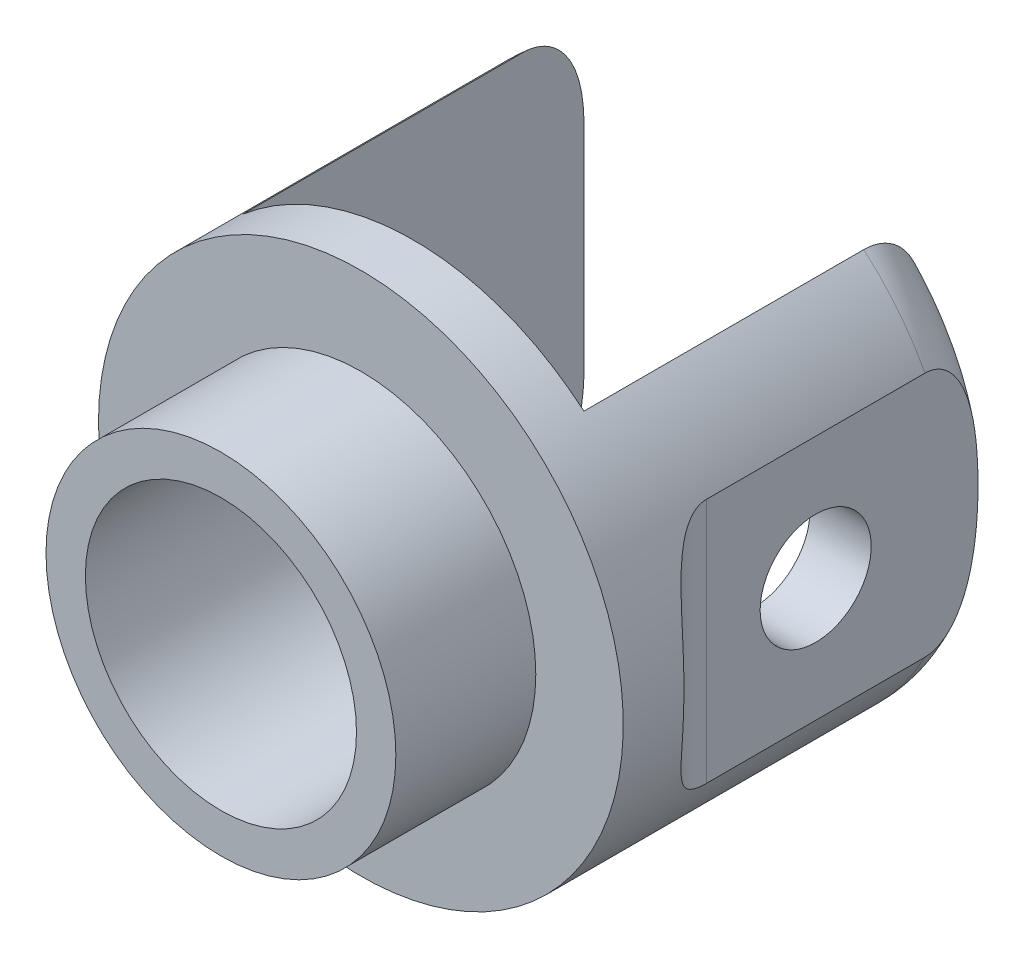
from build123d import *
from build123d.topology import SkipClean

# Parameters (mm, degrees)
SKETCH1_R           = 10
SKETCH1_R_2         = 7.75
BOSS_EXTRUDE1_DEPTH = 8
BOSS_EXTRUDE2_START = 22.5
SKETCH2_R           = 15
SKETCH2_R_2         = 7.75
BOSS_EXTRUDE2_DEPTH = 22.5
CUT_EXTRUDE1_DEPTH  = 19.5
CUT_EXTRUDE2_DEPTH  = 19.5
FILLET2_R           = 3.5
FILLET3_R           = 3.5
SKETCH5_R           = 3.175
CUT_EXTRUDE3_DEPTH  = 28


with BuildPart() as part:
    # Sketch1 → Boss-Extrude1 (new body)
    with BuildSketch(Plane.XY):
        Circle(SKETCH1_R)
        Circle(SKETCH1_R_2, mode=Mode.SUBTRACT)
    extrude(amount=BOSS_EXTRUDE1_DEPTH)

    # Sketch2 → Boss-Extrude2 (add)
    with SkipClean():  # the faces are left unmerged after this step: merging them gives an invalid solid
        with BuildSketch(Plane(origin=(0, 0, 0), x_dir=(-1, 0, 0), z_dir=(0, 0, -1)).offset(BOSS_EXTRUDE2_START)):
            with Locations(Location((0, 0, 0), (0, 0, 180))):
                Circle(SKETCH2_R)
            Circle(SKETCH2_R_2, mode=Mode.SUBTRACT)
        extrude(amount=-BOSS_EXTRUDE2_DEPTH)

    # Sketch3 → Cut-Extrude1 (cut)
    with SkipClean():  # the faces are left unmerged after this step: merging them gives an invalid solid
        with BuildSketch(Plane(origin=(0, 0, -22.5), x_dir=(-1, 0, 0), z_dir=(0, 0, -1))):
            Polygon((-9.75, -18.796133084), (-9.75, 18.796133084), (9.75, 18.796133084), (9.75, -18.796133084), (7.75, -18.796133084), align=None)
        extrude(amount=-CUT_EXTRUDE1_DEPTH, mode=Mode.SUBTRACT)

    # Sketch4 → Cut-Extrude2 (cut)
    with SkipClean():  # the faces are left unmerged after this step: merging them gives an invalid solid
        with BuildSketch(Plane(origin=(0, 0, -22.5), x_dir=(-1, 0, 0), z_dir=(0, 0, -1))):
            Polygon((13.25, 0), (13.25, 9.875321844), (16.822314813, 9.875321844), (16.822314813, -10.062236453), (13.25, -10.062236453), align=None)
            Polygon((-13.25, 0), (-13.25, 9.875321844), (-16.946924552, 9.875321844), (-16.946924552, -10.062236453), (-13.25, -10.062236453), align=None)
        extrude(amount=-CUT_EXTRUDE2_DEPTH, mode=Mode.SUBTRACT)

    # Fillet2
    # the kernel refuses this fillet: 3.5 mm, written as the material it takes off along each edge
    with BuildSketch(Plane(origin=(0, 0, -22.5), x_dir=(-0.9954455514226321, -0.09533181081303158, 0), z_dir=(0.09533181081303158, -0.9954455514226321, 0))) as fillet2_piece_1:
        with BuildLine():
            CenterArc((15 - FILLET2_R, -FILLET2_R), FILLET2_R, 0, 90)
            Line((15 - FILLET2_R, 0), (15, 0))
            Line((15, 0), (15, -FILLET2_R))
        make_face()
    revolve(axis=Axis((0, 0, -22.5), (0, 0, -1)), revolution_arc=88.352120415, mode=Mode.SUBTRACT)
    with BuildSketch(Plane(origin=(0, 0, -22.5), x_dir=(-0.12391837211536041, -0.9922924150935948, 0), z_dir=(0.9922924150935948, -0.12391837211536041, 0))) as fillet2_piece_2:
        with BuildLine():
            CenterArc((15 - FILLET2_R, -FILLET2_R), FILLET2_R, 0, 90)
            Line((15 - FILLET2_R, 0), (15, 0))
            Line((15, 0), (15, -FILLET2_R))
        make_face()
    revolve(axis=Axis((0, 0, -22.5), (0, 0, -1)), revolution_arc=88.352120415, mode=Mode.SUBTRACT)
    with BuildSketch(Plane(origin=(0, 0, -22.5), x_dir=(0.9954455514226316, 0.09533181081303897, 0), z_dir=(-0.09533181081303897, 0.9954455514226316, 0))) as fillet2_piece_3:
        with BuildLine():
            CenterArc((15 - FILLET2_R, -FILLET2_R), FILLET2_R, 0, 90)
            Line((15 - FILLET2_R, 0), (15, 0))
            Line((15, 0), (15, -FILLET2_R))
        make_face()
    revolve(axis=Axis((0, 0, -22.5), (0, 0, -1)), revolution_arc=88.352120415, mode=Mode.SUBTRACT)
    with BuildSketch(Plane(origin=(0, 0, -22.5), x_dir=(0.12391837211539843, 0.9922924150935901, 0), z_dir=(-0.9922924150935901, 0.12391837211539843, 0))) as fillet2_piece_4:
        with BuildLine():
            CenterArc((15 - FILLET2_R, -FILLET2_R), FILLET2_R, 0, 90)
            Line((15 - FILLET2_R, 0), (15, 0))
            Line((15, 0), (15, -FILLET2_R))
        make_face()
    revolve(axis=Axis((0, 0, -22.5), (0, 0, -1)), revolution_arc=88.352120415, mode=Mode.SUBTRACT)

    # Fillet3
    # the kernel refuses this fillet: 3.5 mm, written as the material it adds along each edge
    with BuildSketch(Plane(origin=(13.25, -15.781180555, -3), x_dir=(0, 0, -1), z_dir=(0, 1, 0))) as fillet3_piece_1_section:
        with BuildLine():
            CenterArc((FILLET3_R, -FILLET3_R), FILLET3_R, 90, 90)
            Line((0, -FILLET3_R), (0, 0))
            Line((0, 0), (FILLET3_R, 0))
        make_face()
    fillet3_piece_1 = extrude(amount=31.56236111, mode=Mode.PRIVATE)
    fillet3_piece_1 = fillet3_piece_1 & Plane(origin=(0, 0, -3.991170141), x_dir=(1, 0, 0), z_dir=(0, 0, -1)) * Cylinder(15, 78, mode=Mode.PRIVATE)
    add(fillet3_piece_1)
    with BuildSketch(Plane(origin=(-13.25, 15.781180555, -3), x_dir=(0, 0, -1), z_dir=(0, -1, 0))) as fillet3_piece_2_section:
        with BuildLine():
            CenterArc((FILLET3_R, -FILLET3_R), FILLET3_R, 90, 90)
            Line((0, -FILLET3_R), (0, 0))
            Line((0, 0), (FILLET3_R, 0))
        make_face()
    fillet3_piece_2 = extrude(amount=31.56236111, mode=Mode.PRIVATE)
    fillet3_piece_2 = fillet3_piece_2 & Plane(origin=(0, 0, -3.991154317), x_dir=(1, 0, 0), z_dir=(0, 0, -1)) * Cylinder(15, 78, mode=Mode.PRIVATE)
    add(fillet3_piece_2)

    # Sketch5 → Cut-Extrude3 (cut)
    with BuildSketch(Plane.ZY.offset(13.25)):
        with Locations((-12.749999996, 0)):
            Circle(SKETCH5_R)
    extrude(amount=-CUT_EXTRUDE3_DEPTH, mode=Mode.SUBTRACT)


solid = part.part
